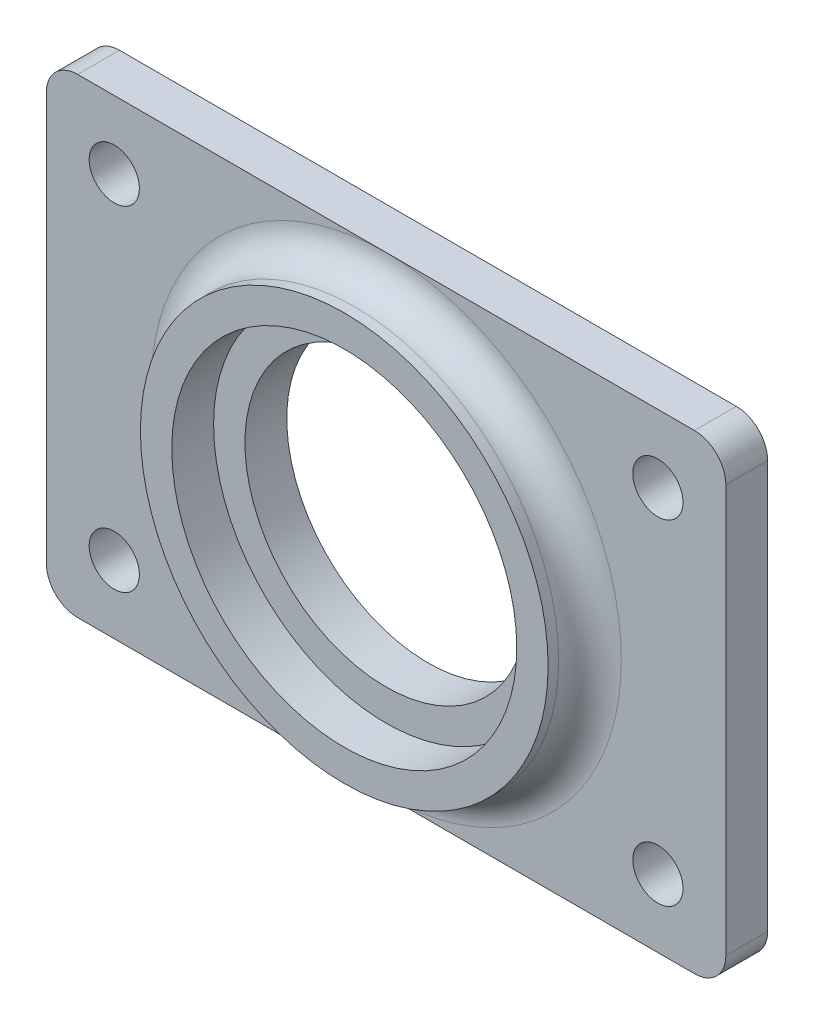
from build123d import *

# Parameters (mm, degrees)
SKETCH1_W            = 65
SKETCH1_H            = 45
SKETCH1_R            = 2
BOSS_EXTRUDE1_DEPTH  = 4
SKETCH4_R            = 19.5
SKETCH4_R_2          = 16.5
BOSS_EXTRUDE3_DEPTH  = 4
SKETCH5_R            = 13.5
CUT_EXTRUDE2_DEPTH   = 40.730341051
M4_CLEARANCE_HOLE1_D = 4.8
FILLET1_R            = 3


with BuildPart() as part:
    # Sketch1 → Boss-Extrude1 (new body)
    # profile 1 of 5: a face of its own
    with BuildSketch(Plane.XY):
        Rectangle(SKETCH1_W, SKETCH1_H)
        with Locations((26, 16)):
            Circle(SKETCH1_R, mode=Mode.SUBTRACT)
        with Locations((26, -16)):
            Circle(SKETCH1_R, mode=Mode.SUBTRACT)
        with Locations((-26, -16)):
            Circle(SKETCH1_R, mode=Mode.SUBTRACT)
        with Locations((-26, 16)):
            Circle(SKETCH1_R, mode=Mode.SUBTRACT)
    # profile 2 of 5: a face of its own
    with BuildSketch(Plane.XY):
        with Locations((-26, 16)):
            Circle(SKETCH1_R)
    # profile 3 of 5: a face of its own
    with BuildSketch(Plane.XY):
        with Locations((-26, -16)):
            Circle(SKETCH1_R)
    # profile 4 of 5: a face of its own
    with BuildSketch(Plane.XY):
        with Locations((26, -16)):
            Circle(SKETCH1_R)
    # profile 5 of 5: a face of its own
    with BuildSketch(Plane.XY):
        with Locations((26, 16)):
            Circle(SKETCH1_R)
    extrude(amount=BOSS_EXTRUDE1_DEPTH)

    # Sketch4 → Boss-Extrude3 (add)
    with BuildSketch(Plane.XY.offset(4)):
        Circle(SKETCH4_R)
        Circle(SKETCH4_R_2, mode=Mode.SUBTRACT)
    extrude(amount=BOSS_EXTRUDE3_DEPTH)

    # Sketch5 → Cut-Extrude2 (cut, through all)
    with BuildSketch(Plane.XY.offset(4)):
        Circle(SKETCH5_R)
    extrude(amount=-CUT_EXTRUDE2_DEPTH, mode=Mode.SUBTRACT)

    # M4 Clearance Hole1 (through all)
    with Locations(Plane.XY.offset(4)):
        with Locations((26, 16), (26, -16), (-26, -16), (-26, 16)):
            Hole(M4_CLEARANCE_HOLE1_D / 2)

    # Fillet1
    fillet1_edges = [part.edges().sort_by_distance(p)[0] for p in [
        (-19.5, 0, 4),
        (32.5, -22.5, 2),
        (-32.5, -22.5, 2),
        (-32.5, 22.5, 2),
        (32.5, 22.5, 2),
    ]]
    fillet(fillet1_edges, radius=FILLET1_R - 0.0001)  # a hair under: the kernel refuses the full size


solid = part.part
